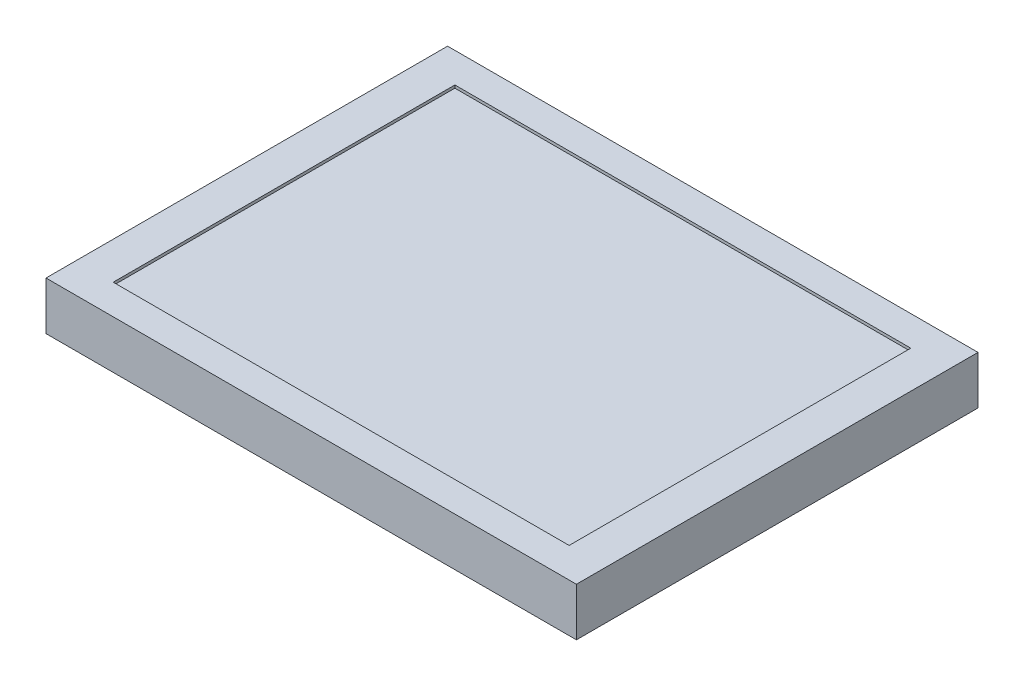
from build123d import *

# Parameters (mm, degrees)
SKETCH1_W               = 94.7
SKETCH1_H               = 71.7
BOSS_EXTRUDE1_DEPTH     = 8.6
BOSS_EXTRUDE2_START     = -0.5
BOSS_EXTRUDE2_OUTLINE_W = 81.4
BOSS_EXTRUDE2_OUTLINE_H = 61
BOSS_EXTRUDE2_DEPTH     = 0.5


# Read off the part's stored shape, not the designer's step: Boss-Extrude2
with BuildPart() as part:
    # Sketch1 → Boss-Extrude1 (new body)
    with BuildSketch(Plane(origin=(0, 0, 0), x_dir=(1, 0, 0), z_dir=(0, 1, 0))):
        with Locations((47.35, 35.85)):
            Rectangle(SKETCH1_W, SKETCH1_H)
    extrude(amount=BOSS_EXTRUDE1_DEPTH)

    # Boss-Extrude2 outline → Boss-Extrude2 (cut)
    with BuildSketch(Plane(origin=(0, 8.6, 0), x_dir=(-1, 0, 0), z_dir=(0, 1, 0)).offset(BOSS_EXTRUDE2_START)):
        with Locations((-47.35, -35.85)):
            Rectangle(BOSS_EXTRUDE2_OUTLINE_W, BOSS_EXTRUDE2_OUTLINE_H)
    extrude(amount=BOSS_EXTRUDE2_DEPTH, mode=Mode.SUBTRACT)


solid = part.part
